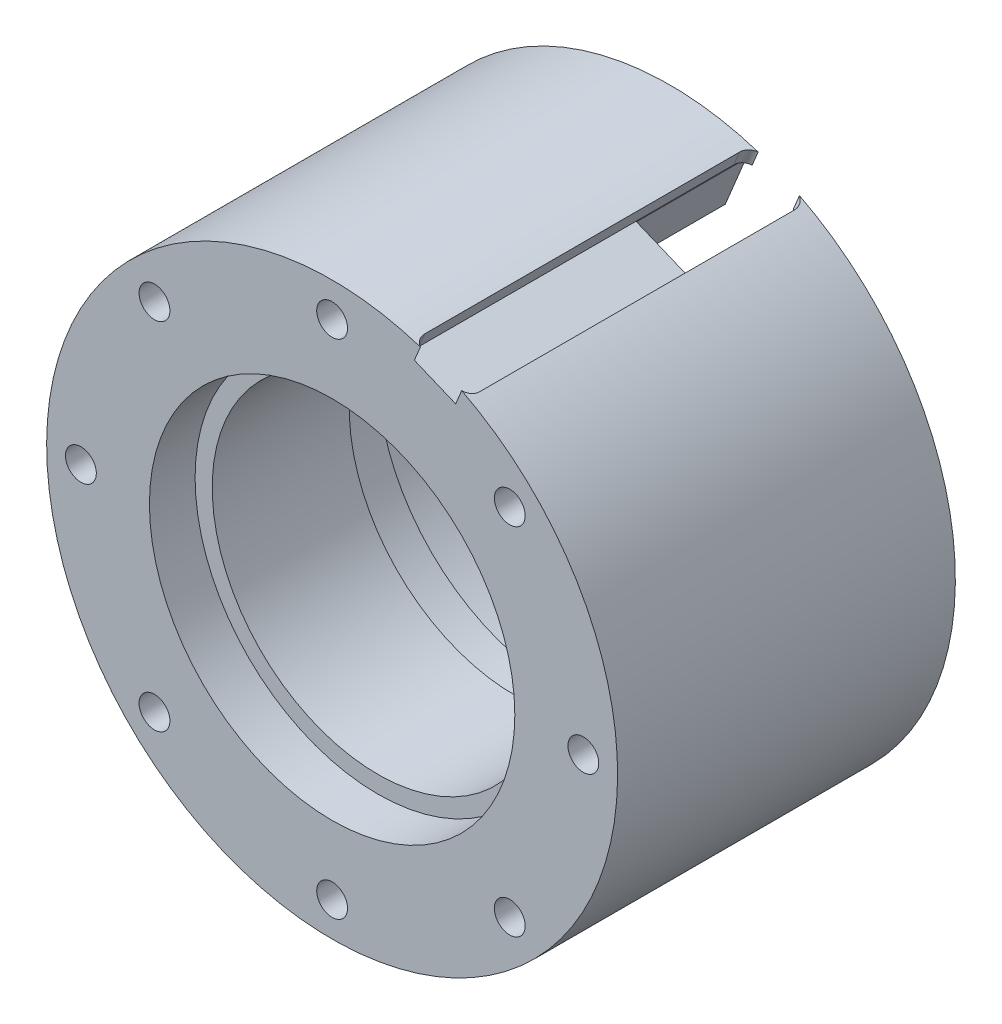
from build123d import *

# Parameters (mm, degrees)
SKETCH3_R               = 1.35
CUT_EXTRUDE2_DEPTH      = 41.415051652
CUT_EXTRUDE4_START      = -2.5
SKETCH4_R               = 2.25
CUT_EXTRUDE4_DEPTH      = 44.120192023
CHAMFER1_SIZE           = 0.1
CIRPATTERN3_COUNT       = 4
CIRPATTERN2_COUNT       = 8
CUT_EXTRUDE5_DEPTH      = 62.04471141
CUT_EXTRUDE6_DEPTH      = 2.55
CUT_EXTRUDE6_DEPTH_BACK = 2.55
SKETCH10_W              = 9.58
SKETCH10_H              = 6


with BuildPart() as part:
    # Sketch7 → Revolve1 (revolve)
    with BuildSketch(Plane(origin=(0, 0, 0), x_dir=(1, 0, 0), z_dir=(0, 1, 0))):
        Polygon((16, 10), (16, 6), (14.5, 6), (14.5, -6), (16, -6), (16, -10), (25, -10), (25, 19.58), (19, 19.58), (19, 10), align=None)
    revolve(axis=Axis((0, 0, 11.479), (0, 0, -1)))

    # Sketch3 → Cut-Extrude2 (cut, symmetric)
    with BuildSketch(Plane.XY):
        with Locations((0, 22)):
            Circle(SKETCH3_R)
    cut_extrude2 = extrude(amount=CUT_EXTRUDE2_DEPTH, both=True, mode=Mode.SUBTRACT)

    # Sketch4 → Cut-Extrude4 (cut)
    with BuildSketch(Plane(origin=(0, 0, -10), x_dir=(-1, 0, 0), z_dir=(0, 0, -1)).offset(CUT_EXTRUDE4_START)):
        with Locations((0, 22)):
            Circle(SKETCH4_R)
    cut_extrude4 = extrude(amount=CUT_EXTRUDE4_DEPTH, mode=Mode.SUBTRACT)

    # Chamfer1
    chamfer1_edges = [part.edges().sort_by_distance(p)[0] for p in [
        (-1.35, 22, -7.5),
    ]]
    chamfer(chamfer1_edges, length=CHAMFER1_SIZE)

    # CirPattern3: Cut-Extrude4 ×4 about axis
    cirpattern3_axis = Axis((0, 0, 11.479), (0, 0, -1))
    for i in range(1, CIRPATTERN3_COUNT):
        add(cut_extrude4.rotate(cirpattern3_axis, i * 360 / CIRPATTERN3_COUNT), mode=Mode.SUBTRACT)

    # CirPattern2: Cut-Extrude2 ×8 about axis
    cirpattern2_axis = Axis((0, 0, 11.479), (0, 0, -1))
    for i in range(1, CIRPATTERN2_COUNT):
        add(cut_extrude2.rotate(cirpattern2_axis, i * 360 / CIRPATTERN2_COUNT), mode=Mode.SUBTRACT)

    # Sketch9 → Cut-Extrude5 (cut, through all)
    with BuildSketch(Plane(origin=(9.012194832, 21.757362991, 0), x_dir=(-0.9238795325112917, 0.3826834323650781, 0), z_dir=(-0.3826834323650781, -0.9238795325112917, 0))):
        with BuildLine():
            Line((-2.6, -9), (-2.6, 18.58))
            ThreePointArc((-2.6, 18.58), (-2.277817459, 19.357817459), (-1.5, 19.68))
            Line((-1.5, 19.68), (1.5, 19.68))
            ThreePointArc((1.5, 19.68), (2.277817459, 19.357817459), (2.6, 18.58))
            Line((2.6, 18.58), (2.6, -9))
            ThreePointArc((2.6, -9), (2.277817459, -9.777817459), (1.5, -10.1))
            Line((1.5, -10.1), (-1.5, -10.1))
            ThreePointArc((-1.5, -10.1), (-2.277817459, -9.777817459), (-2.6, -9))
        make_face()
    extrude(amount=-CUT_EXTRUDE5_DEPTH, mode=Mode.SUBTRACT)

    # Sketch10 → Cut-Extrude6 (cut, two sides: drawn at the far end of the back side and taken through both)
    with BuildSketch(Plane(origin=(0, 0, 0), x_dir=(0, 0, -1), z_dir=(0.9238795325112916, -0.38268343236507807, 0)).offset(-CUT_EXTRUDE6_DEPTH_BACK)):
        with Locations((14.79, 20.55)):
            Rectangle(SKETCH10_W, SKETCH10_H)
    extrude(amount=CUT_EXTRUDE6_DEPTH + CUT_EXTRUDE6_DEPTH_BACK, mode=Mode.SUBTRACT)


solid = part.part
